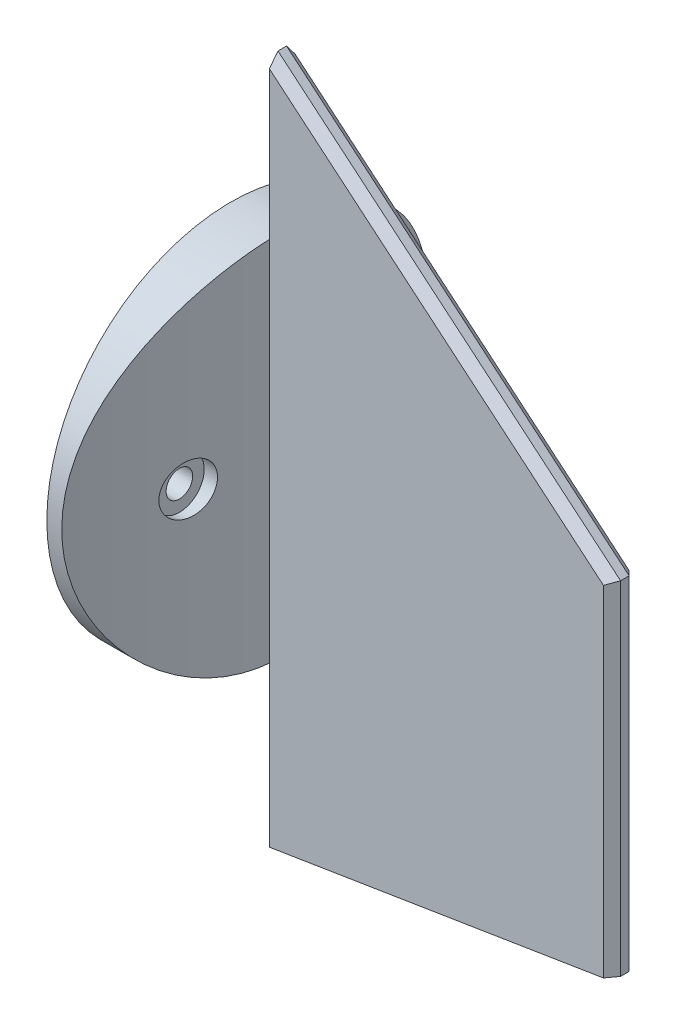
from build123d import *
from build123d.topology import SkipClean

# Parameters (mm, degrees)
SKETCH13_R               = 16.367500031
BOSS_EXTRUDE11_DEPTH     = 0.762
SKETCH14_R               = 16.367500031
BOSS_EXTRUDE12_DEPTH     = 0.508
BOSS_EXTRUDE13_DEPTH     = 0.9525
CHAMFER6_SIZE            = 0.762
BOSS_EXTRUDE19_DEPTH     = 1.016
BOSS_EXTRUDE20_START     = 1.524
BOSS_EXTRUDE20_DEPTH     = 1.524
SKETCH28_R               = 2.2098
CUT_EXTRUDE9_DEPTH       = 1.524
SKETCH29_R               = 1.1811
CUT_EXTRUDE10_DEPTH      = 14.224
CUT_EXTRUDE15_START      = 52.832
SKETCH35_R               = 16.367500031
CUT_EXTRUDE15_DEPTH      = 52.832
CUT_EXTRUDE16_DEPTH      = 52.832
CUT_EXTRUDE16_DEPTH_BACK = 52.832
SKETCH36_R               = 29.172390064
SKETCH36_R_2             = 16.367500031
CUT_EXTRUDE17_DEPTH      = 52.832
CUT_EXTRUDE17_DEPTH_BACK = 52.832
BOSS_EXTRUDE21_DEPTH     = 1.143
CHAMFER7_SIZE            = 0.762
SKETCH41_R               = 2.921
CUT_EXTRUDE19_DEPTH      = 1.524
SKETCH42_R               = 4.064
CUT_EXTRUDE20_DEPTH      = 0.762
SKETCH43_R               = 2.921
CUT_EXTRUDE21_DEPTH      = 0.508
CUT_EXTRUDE24_DEPTH      = 0.9398
CUT_EXTRUDE24_DEPTH_BACK = 0.9398
SKETCH44_R               = 5.4102
SKETCH46_R               = 2.921
CUT_EXTRUDE25_DEPTH      = 0.508
SKETCH47_R               = 16.367500031
SKETCH47_R_2             = 1.1811
SKETCH47_R_3             = 5.4102
BOSS_EXTRUDE22_DEPTH     = 1.016
BOSS_EXTRUDE23_START     = 1.524
SKETCH48_R               = 5.4102
SKETCH48_R_2             = 2.921
BOSS_EXTRUDE23_DEPTH     = 1.524
BOSS_EXTRUDE24_START     = 0.762
SKETCH49_R               = 2.921
BOSS_EXTRUDE24_DEPTH     = 0.762
CUT_EXTRUDE26_START      = -1.6002
SKETCH51_R               = 5.4102
CUT_EXTRUDE26_DEPTH      = 1.6002


with BuildPart() as part:
    # Sketch13 → Boss-Extrude11 (new, symmetric)
    with BuildSketch(Plane(origin=(0, 0, 0), x_dir=(0, 0, -1), z_dir=(1, 0, 0))):
        with Locations(Location((0, 0, 0), (0, 0, 180))):
            Circle(SKETCH13_R)
        with BuildLine():
            Line((-2.621749746, -2.242527206), (-1.817157123, -14.183327087))
            ThreePointArc((-1.817157123, -14.183327087), (0.203701313, -16.048707293), (2.176562947, -14.132636025))
            Line((2.176562947, -14.132636025), (2.677823379, -2.175261352))
            ThreePointArc((2.677823379, -2.175261352), (-0.043786264, 3.449722128), (-2.621749746, -2.242527206))
        make_face(mode=Mode.SUBTRACT)
    extrude(amount=BOSS_EXTRUDE11_DEPTH, both=True)

    # Sketch14 → Boss-Extrude12 (add, symmetric)
    with BuildSketch(Plane(origin=(0.762, 0, 0), x_dir=(0, 0, -1), z_dir=(1, 0, 0))):
        with Locations(Location((0, 0, 0), (0, 0, 180))):
            Circle(SKETCH14_R)
    extrude(amount=BOSS_EXTRUDE12_DEPTH, both=True)

    # Sketch15 → Boss-Extrude13 (add, symmetric)
    with BuildSketch(Plane.XY):
        Polygon((1.27, 0), (1.27, 25.4), (26.67, 4.086869368), (26.67, -21.313130632), (1.27, -25.4), align=None)
    extrude(amount=BOSS_EXTRUDE13_DEPTH, both=True)

    # Chamfer6
    chamfer6_edges = [part.edges().sort_by_distance(p)[0] for p in [
        (26.67, -8.613130632, -0.9525),
        (13.97, 14.743434684, -0.9525),
        (26.67, -8.613130632, 0.9525),
        (13.97, 14.743434684, 0.9525),
    ]]
    chamfer(chamfer6_edges, length=CHAMFER6_SIZE)

    # Sketch26 → Boss-Extrude19 (add)
    with BuildSketch(Plane.ZY.offset(-0.254)):
        with BuildLine():
            Line((-2.677823379, -2.175261352), (-2.176562947, -14.132636025))
            ThreePointArc((-2.176562947, -14.132636025), (-0.203701313, -16.048707293), (1.817157123, -14.183327087))
            Line((1.817157123, -14.183327087), (2.621749746, -2.242527206))
            ThreePointArc((2.621749746, -2.242527206), (0.043786264, 3.449722128), (-2.677823379, -2.175261352))
        make_face()
    extrude(amount=BOSS_EXTRUDE19_DEPTH)

    # Sketch27 → Boss-Extrude20 (add)
    with BuildSketch(Plane(origin=(1.27, 0, 0), x_dir=(0, 0, -1), z_dir=(1, 0, 0)).offset(BOSS_EXTRUDE20_START)):
        with BuildLine():
            Line((0.9525, 16.339761351), (0.9525, -16.339761351))
            ThreePointArc((0.9525, -16.339761351), (16.367500031, 0), (0.9525, 16.339761351))
        make_face()
        with BuildLine():
            Line((-0.9525, -16.339761351), (-0.9525, 16.339761351))
            ThreePointArc((-0.9525, 16.339761351), (-16.367500031, 0), (-0.9525, -16.339761351))
        make_face()
    extrude(amount=-BOSS_EXTRUDE20_DEPTH)

    # Sketch28 → Cut-Extrude9 (cut)
    with BuildSketch(Plane(origin=(2.794, 0, 0), x_dir=(0, 0, -1), z_dir=(1, 0, 0))):
        with Locations((-7.624820031, 0)):
            Circle(SKETCH28_R)
        with Locations((7.624820031, 0)):
            Circle(SKETCH28_R)
    extrude(amount=-CUT_EXTRUDE9_DEPTH, mode=Mode.SUBTRACT)

    # Sketch29 → Cut-Extrude10 (cut)
    with BuildSketch(Plane(origin=(1.27, 0, 0), x_dir=(0, 0, -1), z_dir=(1, 0, 0))):
        with Locations((-7.624820031, 0)):
            Circle(SKETCH29_R)
        with Locations((7.624820031, 0)):
            Circle(SKETCH29_R)
    extrude(amount=-CUT_EXTRUDE10_DEPTH, mode=Mode.SUBTRACT)

    # Sketch35 → Cut-Extrude15 (cut)
    with BuildSketch(Plane(origin=(2.794, 0, 0), x_dir=(0, 0, -1), z_dir=(1, 0, 0)).offset(CUT_EXTRUDE15_START)):
        with Locations(Location((0, 0, 0), (0, 0, 266.663810568))):
            Circle(SKETCH35_R)
    extrude(amount=-CUT_EXTRUDE15_DEPTH, mode=Mode.SUBTRACT)

    # Sketch36 → Cut-Extrude16 (cut, two sides: drawn at the far end of the back side and taken through both)
    with SkipClean():  # the faces are left unmerged after this step: merging them gives an invalid solid
        with BuildSketch(Plane(origin=(2.794, 0, 0), x_dir=(0, 0, -1), z_dir=(1, 0, 0)).offset(-CUT_EXTRUDE16_DEPTH_BACK)):
            Circle(SKETCH36_R)
            with Locations(Location((0, 0, 0), (0, 0, 180))):
                Circle(SKETCH36_R_2, mode=Mode.SUBTRACT)
        extrude(amount=CUT_EXTRUDE16_DEPTH + CUT_EXTRUDE16_DEPTH_BACK, mode=Mode.SUBTRACT)
    add(part.part.scale(1), mode=Mode.REPLACE)  # the faces are merged on a copy

    # Sketch33 → Cut-Extrude17 (cut, two sides: drawn at the far end of the back side and taken through both)
    with SkipClean():  # the faces are left unmerged after this step: merging them gives an invalid solid
        with BuildSketch(Plane(origin=(0, 0, 0), x_dir=(1, 0, 0), z_dir=(0, 1, 0)).offset(-CUT_EXTRUDE17_DEPTH_BACK)):
            with BuildLine():
                ThreePointArc((2.794, 0), (1.974703997, -8.34312313), (-0.451883084, -16.367500031))
                Line((-0.451883084, -16.367500031), (2.794, -16.367500031))
                Line((2.794, -16.367500031), (2.794, 0))
            make_face()
            with BuildLine():
                Line((2.794, 16.367500031), (-0.451883084, 16.367500031))
                ThreePointArc((-0.451883084, 16.367500031), (1.974703997, 8.34312313), (2.794, 0))
                Line((2.794, 0), (2.794, 16.367500031))
            make_face()
        extrude(amount=CUT_EXTRUDE17_DEPTH + CUT_EXTRUDE17_DEPTH_BACK, mode=Mode.SUBTRACT)
    add(part.part.scale(1), mode=Mode.REPLACE)  # the faces are merged on a copy

    # Sketch41 → Cut-Extrude19 (cut)
    with SkipClean():  # the faces are left unmerged after this step: merging them gives an invalid solid
        with BuildSketch(Plane.ZY.offset(0.762)):
            Circle(SKETCH41_R)
        extrude(amount=-CUT_EXTRUDE19_DEPTH, mode=Mode.SUBTRACT)

    # Sketch42 → Cut-Extrude20 (cut, symmetric)
    with SkipClean():  # the faces are left unmerged after this step: merging them gives an invalid solid
        with BuildSketch(Plane.ZY.offset(0.762)):
            Circle(SKETCH42_R)
        extrude(amount=CUT_EXTRUDE20_DEPTH, both=True, mode=Mode.SUBTRACT)

    # Sketch43 → Cut-Extrude21 (cut, symmetric)
    with SkipClean():  # the faces are left unmerged after this step: merging them gives an invalid solid
        with BuildSketch(Plane.ZY.offset(-0.762)):
            Circle(SKETCH43_R)
        extrude(amount=CUT_EXTRUDE21_DEPTH, both=True, mode=Mode.SUBTRACT)

    # Sketch44 → Cut-Extrude24 (cut, two sides: drawn at the far end of the back side and taken through both)
    with SkipClean():  # the faces are left unmerged after this step: merging them gives an invalid solid
        with BuildSketch(Plane.ZY.offset(-CUT_EXTRUDE24_DEPTH_BACK)):
            with Locations(Location((0, 0, 0), (0, 0, 180))):
                Circle(SKETCH44_R)
        extrude(amount=CUT_EXTRUDE24_DEPTH + CUT_EXTRUDE24_DEPTH_BACK, mode=Mode.SUBTRACT)

    # Sketch46 → Cut-Extrude25 (cut)
    with SkipClean():  # the faces are left unmerged after this step: merging them gives an invalid solid
        with BuildSketch(Plane.ZY.offset(-1.27)):
            Circle(SKETCH46_R)
        extrude(amount=-CUT_EXTRUDE25_DEPTH, mode=Mode.SUBTRACT)

    # Sketch47 → Boss-Extrude22 (add)
    with SkipClean():  # the faces are left unmerged after this step: merging them gives an invalid solid
        with BuildSketch(Plane.ZY.offset(0.762)):
            Circle(SKETCH47_R)
            with Locations(Location((7.624820031, 0, 0), (0, 0, 180))):
                Circle(SKETCH47_R_2, mode=Mode.SUBTRACT)
            with Locations(Location((-7.624820031, 0, 0), (0, 0, 180))):
                Circle(SKETCH47_R_2, mode=Mode.SUBTRACT)
            Circle(SKETCH47_R_3, mode=Mode.SUBTRACT)
        extrude(amount=BOSS_EXTRUDE22_DEPTH)

    # Sketch48 → Boss-Extrude23 (add)
    with SkipClean():  # the faces are left unmerged after this step: merging them gives an invalid solid
        with BuildSketch(Plane.ZY.offset(-0.9398).offset(BOSS_EXTRUDE23_START)):
            Circle(SKETCH48_R)
            Circle(SKETCH48_R_2, mode=Mode.SUBTRACT)
        extrude(amount=-BOSS_EXTRUDE23_DEPTH)

    # Sketch49 → Boss-Extrude24 (add)
    with SkipClean():  # the faces are left unmerged after this step: merging them gives an invalid solid
        with BuildSketch(Plane.ZY.offset(-1.778).offset(BOSS_EXTRUDE24_START)):
            Circle(SKETCH49_R)
        extrude(amount=-BOSS_EXTRUDE24_DEPTH)

    # Sketch51 → Cut-Extrude26 (cut)
    with SkipClean():  # the faces are left unmerged after this step: merging them gives an invalid solid
        with BuildSketch(Plane.ZY.offset(0.5842).offset(CUT_EXTRUDE26_START)):
            Circle(SKETCH51_R)
        extrude(amount=CUT_EXTRUDE26_DEPTH, mode=Mode.SUBTRACT)


with BuildPart() as body_2:
    # Sketch38 → Boss-Extrude21 (new, symmetric)
    with BuildSketch(Plane(origin=(0, 0, 0), x_dir=(-1, 0, 0), z_dir=(0, 0, -1))):
        Polygon((-33.274, 4.904243242), (-2.794, 30.48), (-2.794, 0), (-2.794, -30.48), (-33.274, -25.575756758), align=None)
    extrude(amount=BOSS_EXTRUDE21_DEPTH, both=True)

    # Chamfer7
    chamfer7_edges = [body_2.edges().sort_by_distance(p)[0] for p in [
        (33.274, -10.335756758, -1.143),
        (18.034, 17.692121621, -1.143),
        (33.274, -10.335756758, 1.143),
        (18.034, 17.692121621, 1.143),
    ]]
    chamfer(chamfer7_edges, length=CHAMFER7_SIZE)


solid = Compound([part.part, body_2.part])
